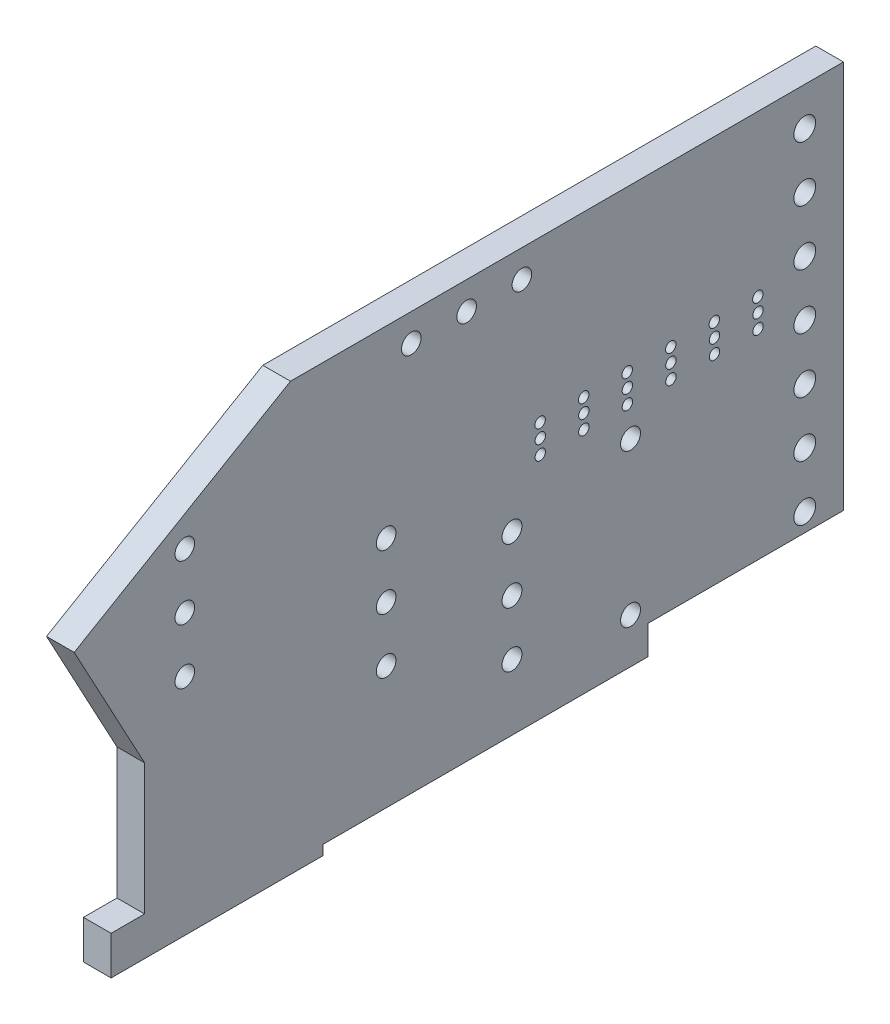
from build123d import *

# Parameters (mm, degrees)
SKETCH2_R           = 2.5
SKETCH2_R_2         = 2.2479
SKETCH2_R_3         = 2.288239151
SKETCH2_R_4         = 2.286
SKETCH2_R_5         = 1.2
BOSS_EXTRUDE3_DEPTH = 6.35
SKETCH2_8_W         = 17.721497707
SKETCH2_8_H         = 5.615097192
BOSS_EXTRUDE7_DEPTH = 11.176
BOSS_EXTRUDE8_DEPTH = 6.35
SKETCH4_R           = 1
CUT_EXTRUDE1_DEPTH  = 1.4224
BOSS_EXTRUDE9_DEPTH = 11.176
SKETCH5_R           = 1
CUT_EXTRUDE2_DEPTH  = 0.762


with BuildPart() as part:
    # Sketch2 → Boss-Extrude3 (new body)
    with BuildSketch(Plane(origin=(0, 0, 0), x_dir=(0, 0, -1), z_dir=(1, 0, 0))):
        Polygon((16.17094154, 0), (8.480621378, 0), (8.480621378, -8.89), (57.15, -8.89), (57.15, 0), (176.670010733, 0), (176.670010733, 89.2048), (49.670010733, 89.2048), (0, 60.116195388), (16.17094154, 30.058097694), align=None)
        with Locations((167.780010733, 80.416979557)):
            Circle(SKETCH2_R, mode=Mode.SUBTRACT)
        with Locations((71.642065552, 21.59)):
            Circle(SKETCH2_R_2, mode=Mode.SUBTRACT)
        with Locations((71.642065552, 34.29)):
            Circle(SKETCH2_R_2, mode=Mode.SUBTRACT)
        with Locations((100.543356523, 8.4455)):
            Circle(SKETCH2_R_3, mode=Mode.SUBTRACT)
        with Locations((127.772156523, 3.6703)):
            Circle(SKETCH2_R_4, mode=Mode.SUBTRACT)
        with Locations((167.780010733, 4.216979557)):
            Circle(SKETCH2_R, mode=Mode.SUBTRACT)
        with Locations((100.543356523, 21.1455)):
            Circle(SKETCH2_R_3, mode=Mode.SUBTRACT)
        with Locations((100.543356523, 33.8455)):
            Circle(SKETCH2_R_3, mode=Mode.SUBTRACT)
        with Locations((127.772156523, 38.7223)):
            Circle(SKETCH2_R_4, mode=Mode.SUBTRACT)
        with Locations((167.780010733, 16.916979557)):
            Circle(SKETCH2_R, mode=Mode.SUBTRACT)
        with Locations((167.780010733, 29.616979557)):
            Circle(SKETCH2_R, mode=Mode.SUBTRACT)
        with Locations((25.4, 42.6212)):
            Circle(SKETCH2_R_2, mode=Mode.SUBTRACT)
        with Locations((25.4, 55.3212)):
            Circle(SKETCH2_R_2, mode=Mode.SUBTRACT)
        with Locations((71.642065552, 46.99)):
            Circle(SKETCH2_R_2, mode=Mode.SUBTRACT)
        with Locations((25.4, 68.0212)):
            Circle(SKETCH2_R_2, mode=Mode.SUBTRACT)
        with Locations((77.419204984, 82.8548)):
            Circle(SKETCH2_R_2, mode=Mode.SUBTRACT)
        with Locations((107.050066379, 45.916309191)):
            Circle(SKETCH2_R_5, mode=Mode.SUBTRACT)
        with Locations((107.050066379, 49.192931478)):
            Circle(SKETCH2_R_5, mode=Mode.SUBTRACT)
        with Locations((107.01010757, 52.349677339)):
            Circle(SKETCH2_R_5, mode=Mode.SUBTRACT)
        with Locations((117.050066379, 45.916309191)):
            Circle(SKETCH2_R_5, mode=Mode.SUBTRACT)
        with Locations((127.050066379, 45.916309191)):
            Circle(SKETCH2_R_5, mode=Mode.SUBTRACT)
        with Locations((117.050066379, 49.192931478)):
            Circle(SKETCH2_R_5, mode=Mode.SUBTRACT)
        with Locations((117.01010757, 52.349677339)):
            Circle(SKETCH2_R_5, mode=Mode.SUBTRACT)
        with Locations((127.050066379, 49.192931478)):
            Circle(SKETCH2_R_5, mode=Mode.SUBTRACT)
        with Locations((127.01010757, 52.349677339)):
            Circle(SKETCH2_R_5, mode=Mode.SUBTRACT)
        with Locations((137.050066379, 45.916309191)):
            Circle(SKETCH2_R_5, mode=Mode.SUBTRACT)
        with Locations((147.050066379, 45.916309191)):
            Circle(SKETCH2_R_5, mode=Mode.SUBTRACT)
        with Locations((137.050066379, 49.192931478)):
            Circle(SKETCH2_R_5, mode=Mode.SUBTRACT)
        with Locations((137.01010757, 52.349677339)):
            Circle(SKETCH2_R_5, mode=Mode.SUBTRACT)
        with Locations((147.050066379, 49.192931478)):
            Circle(SKETCH2_R_5, mode=Mode.SUBTRACT)
        with Locations((147.01010757, 52.349677339)):
            Circle(SKETCH2_R_5, mode=Mode.SUBTRACT)
        with Locations((157.050066379, 45.916309191)):
            Circle(SKETCH2_R_5, mode=Mode.SUBTRACT)
        with Locations((167.780010733, 42.316979557)):
            Circle(SKETCH2_R, mode=Mode.SUBTRACT)
        with Locations((157.050066379, 49.192931478)):
            Circle(SKETCH2_R_5, mode=Mode.SUBTRACT)
        with Locations((157.01010757, 52.349677339)):
            Circle(SKETCH2_R_5, mode=Mode.SUBTRACT)
        with Locations((167.780010733, 55.016979557)):
            Circle(SKETCH2_R, mode=Mode.SUBTRACT)
        with Locations((90.119204984, 82.8548)):
            Circle(SKETCH2_R_2, mode=Mode.SUBTRACT)
        with Locations((102.819204984, 82.8548)):
            Circle(SKETCH2_R_2, mode=Mode.SUBTRACT)
        with Locations((167.780010733, 67.716979557)):
            Circle(SKETCH2_R, mode=Mode.SUBTRACT)
    extrude(amount=-BOSS_EXTRUDE3_DEPTH)



with BuildPart() as body_2:
    # Sketch2<8> → Boss-Extrude7 (new body)
    with BuildSketch(Plane(origin=(0, 0, 0), x_dir=(0, 0, -1), z_dir=(1, 0, 0))):
        with Locations((122.876603321, -3.836248596)):
            Rectangle(SKETCH2_8_W, SKETCH2_8_H)
    extrude(amount=-BOSS_EXTRUDE7_DEPTH)


with BuildPart() as part_1:
    add(part.part)

    add(body_2.part)  # Boss-Extrude8 merges body 2
    # Sketch2<9> → Boss-Extrude8 (add)
    with BuildSketch(Plane(origin=(0, 0, 0), x_dir=(0, 0, -1), z_dir=(1, 0, 0))):
        Polygon((57.15, 0), (57.15, -6.643797192), (114.015854467, -6.643797192), (114.015854467, -1.0287), (131.737352174, -1.0287), (131.737352174, 0), align=None)
    extrude(amount=-BOSS_EXTRUDE8_DEPTH)

    # Sketch4 → Cut-Extrude1 (cut)
    with BuildSketch(Plane.XZ.offset(6.643797192)):
        Polygon((-5.453740578, -118.95), (-2.566989232, -118.95), (-1.123613559, -121.45), (-2.566989232, -123.95), (-5.453740578, -123.95), (-6.897116251, -121.45), align=None)
        with Locations((-4.010364905, -121.45)):
            Circle(SKETCH4_R, mode=Mode.SUBTRACT)
    extrude(amount=-CUT_EXTRUDE1_DEPTH, mode=Mode.SUBTRACT)

    # Sketch2<10> → Boss-Extrude9 (add)
    with BuildSketch(Plane(origin=(0, 0, 0), x_dir=(0, 0, -1), z_dir=(1, 0, 0))):
        Polygon((57.15, 0), (22.86, 0), (22.86, -8.89), (57.15, -8.89), (57.15, -6.643797192), align=None)
    extrude(amount=-BOSS_EXTRUDE9_DEPTH)

    # Sketch5 → Cut-Extrude2 (cut)
    with BuildSketch(Plane.XZ.offset(8.89)):
        Polygon((-6.604375673, -50.2), (-3.717624327, -50.2), (-2.274248654, -52.7), (-3.717624327, -55.2), (-6.604375673, -55.2), (-8.047751346, -52.7), align=None)
        with Locations((-5.161, -52.7)):
            Circle(SKETCH5_R, mode=Mode.SUBTRACT)
    extrude(amount=-CUT_EXTRUDE2_DEPTH, mode=Mode.SUBTRACT)


solid = part_1.part
